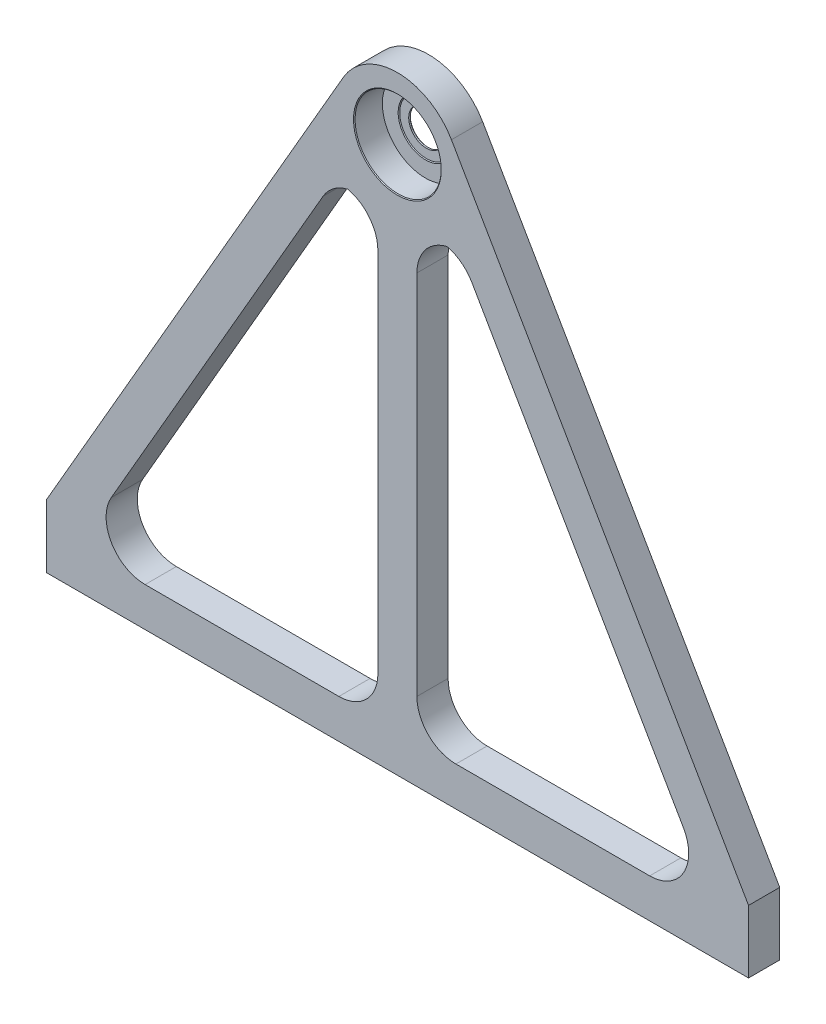
from build123d import *

# Parameters (mm, degrees)
BOSS_EXTRUDE1_DEPTH = 4
SKETCH2_R           = 11.05
CUT_EXTRUDE1_DEPTH  = 7.2
SKETCH3_R           = 7
CUT_EXTRUDE2_DEPTH  = 0.2
SKETCH4_R           = 4.5
CUT_EXTRUDE3_DEPTH  = 186.073210739
CHAMFER1_SIZE       = 0.2
CUT_EXTRUDE4_DEPTH  = 186.09817215
SKETCH8_W           = 10
SKETCH8_H           = 114
EXTRUDE_THIN1_DEPTH = 8
FILLET1_R           = 10
SKETCH6_OUTSIDE_W   = 251.144
SKETCH6_OUTSIDE_H   = 208.536
SKETCH6_OUTSIDE_W_2 = 180
SKETCH6_OUTSIDE_H_2 = 156
CUT_EXTRUDE5_DEPTH  = 186.09817215


# Some blends are built 0.0001 mm under size
with BuildPart() as part:
    # Sketch1 → Boss-Extrude1 (new, symmetric)
    with BuildSketch(Plane.XY):
        with BuildLine():
            Line((0, 0), (-99.304246301, 0))
            Line((-99.304246301, 0), (-13.856406461, 148))
            ThreePointArc((-13.856406461, 148), (0, 156), (13.856406461, 148))
            Line((13.856406461, 148), (99.304246301, 0))
            Line((99.304246301, 0), (0, 0))
        make_face()
    extrude(amount=BOSS_EXTRUDE1_DEPTH, both=True)

    # Sketch2 → Cut-Extrude1 (cut)
    with BuildSketch(Plane.XY.offset(4)):
        with Locations((0, 140)):
            Circle(SKETCH2_R)
    extrude(amount=-CUT_EXTRUDE1_DEPTH, mode=Mode.SUBTRACT)

    # Sketch3 → Cut-Extrude2 (cut)
    with BuildSketch(Plane.XY.offset(-3.2)):
        with Locations((0, 140)):
            Circle(SKETCH3_R)
    extrude(amount=-CUT_EXTRUDE2_DEPTH, mode=Mode.SUBTRACT)

    # Sketch4 → Cut-Extrude3 (cut, through all)
    with BuildSketch(Plane.XY.offset(-3.4)):
        with Locations((0, 140)):
            Circle(SKETCH4_R)
    extrude(amount=-CUT_EXTRUDE3_DEPTH, mode=Mode.SUBTRACT)

    # Chamfer1
    chamfer1_edges = [part.edges().sort_by_distance(p)[0] for p in [
        (-11.05, 140, 4),
        (-7, 140, -3.4),
        (-4.5, 140, -4),
    ]]
    chamfer(chamfer1_edges, length=CHAMFER1_SIZE - 0.0001)  # a hair under: the kernel refuses the full size

    # Sketch5 → Cut-Extrude4 (cut, through all)
    with BuildSketch(Plane.XY.offset(4)):
        Polygon((-16.165807537, 124), (16.165807537, 124), (81.983738225, 10), (-81.983738225, 10), align=None)
    extrude(amount=-CUT_EXTRUDE4_DEPTH, mode=Mode.SUBTRACT)

    # Sketch8 → Extrude-Thin1 (add)
    with BuildSketch(Plane.XY.offset(4)):
        with Locations((0, 67)):
            Rectangle(SKETCH8_W, SKETCH8_H)
    extrude(amount=-EXTRUDE_THIN1_DEPTH)

    # Fillet1
    # the kernel refuses this fillet: 10 mm, written as the material it adds along each edge
    with BuildSketch(Plane(origin=(81.983738225, 10, 4), x_dir=(-0.5000000000000037, 0.8660254037844365, 0), z_dir=(0, 0, -1)), Plane(origin=(-81.983738225, 10, 4), x_dir=(1, 0, 0), z_dir=(0, 0, -1))) as fillet1_piece_1:
        with BuildLine():
            CenterArc((FILLET1_R * 1.73205080757, -FILLET1_R), FILLET1_R, 90, 120)
            Line((FILLET1_R * 0.866025403784, -FILLET1_R * 1.5), (0, 0))
            Line((0, 0), (FILLET1_R * 1.73205080757, 0))
        make_face()
    extrude(amount=8)
    with BuildSketch(Plane(origin=(16.165807537, 124, 4), x_dir=(-1, 0, 0), z_dir=(0, 0, -1))) as fillet1_piece_2:
        with BuildLine():
            CenterArc((FILLET1_R * 0.57735026919, -FILLET1_R), FILLET1_R, 90, 60)
            Line((-FILLET1_R * 0.288675134595, -FILLET1_R * 0.5), (0, 0))
            Line((0, 0), (FILLET1_R * 0.57735026919, 0))
        make_face()
    extrude(amount=8)
    with BuildSketch(Plane(origin=(-16.165807537, 124, 4), x_dir=(1, 0, 0), z_dir=(0, 0, -1))) as fillet1_piece_3:
        with BuildLine():
            CenterArc((FILLET1_R * 0.57735026919, FILLET1_R), FILLET1_R, 210, 60)
            Line((-FILLET1_R * 0.288675134595, FILLET1_R * 0.5), (0, 0))
            Line((0, 0), (FILLET1_R * 0.57735026919, 0))
        make_face()
    extrude(amount=8)
    with BuildSketch(Plane(origin=(-5, 10, 4), x_dir=(-1, 0, 0), z_dir=(0, 0, -1)), Plane(origin=(5, 124, 4), x_dir=(1, 0, 0), z_dir=(0, 0, -1))) as fillet1_piece_4:
        with BuildLine():
            CenterArc((FILLET1_R, FILLET1_R), FILLET1_R, 180, 90)
            Line((0, FILLET1_R), (0, 0))
            Line((0, 0), (FILLET1_R, 0))
        make_face()
    extrude(amount=8)
    with BuildSketch(Plane(origin=(5, 10, 4), x_dir=(1, 0, 0), z_dir=(0, 0, -1)), Plane(origin=(-5, 124, 4), x_dir=(-1, 0, 0), z_dir=(0, 0, -1))) as fillet1_piece_5:
        with BuildLine():
            CenterArc((FILLET1_R, -FILLET1_R), FILLET1_R, 90, 90)
            Line((0, -FILLET1_R), (0, 0))
            Line((0, 0), (FILLET1_R, 0))
        make_face()
    extrude(amount=8)

    # Sketch6 outside → Cut-Extrude5 (cut, through all)
    with BuildSketch(Plane.XY.offset(4)):
        with Locations((0, 78)):
            Rectangle(SKETCH6_OUTSIDE_W, SKETCH6_OUTSIDE_H)
        with Locations((0, 78)):
            Rectangle(SKETCH6_OUTSIDE_W_2, SKETCH6_OUTSIDE_H_2, mode=Mode.SUBTRACT)
    extrude(amount=-CUT_EXTRUDE5_DEPTH, mode=Mode.SUBTRACT)


solid = part.part
